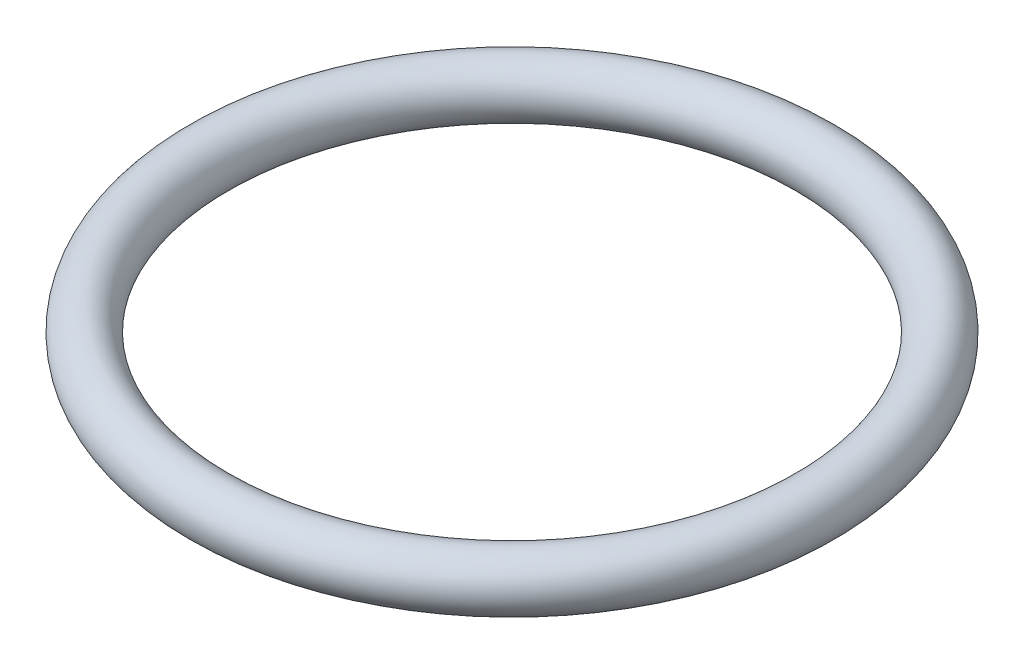
from build123d import *

# Parameters (mm, degrees)
SKETCH1_R = 1.25


with BuildPart() as part:
    # Sketch1 → Revolve1 (revolve)
    with BuildSketch(Plane.XY):
        with Locations((-13.97, 0)):
            Circle(SKETCH1_R)
    revolve(axis=Axis((0, 0, 0), (0, 1, 0)))


solid = part.part
